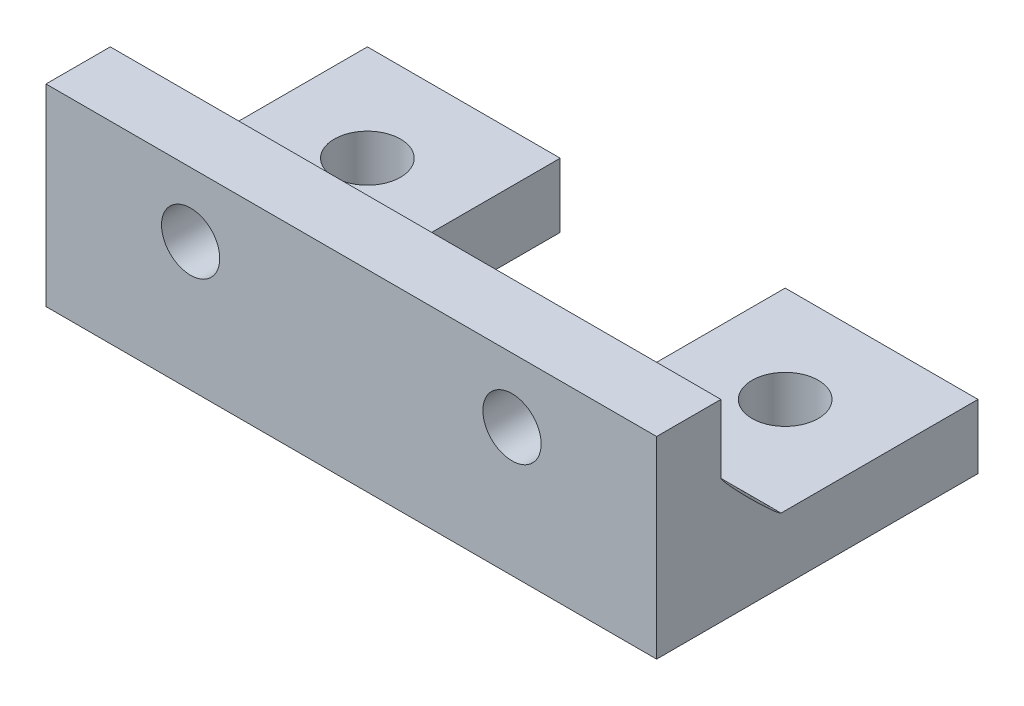
from build123d import *

# Parameters (mm, degrees)
SKETCH1_W           = 30.4
SKETCH1_H           = 6.4
BOSS_EXTRUDE1_DEPTH = 3.2
SKETCH2_W           = 9.6
SKETCH2_H           = 9.6
SKETCH2_R           = 1.65
BOSS_EXTRUDE2_DEPTH = 3.2
SKETCH3_W           = 30.4
SKETCH3_H           = 3.2
BOSS_EXTRUDE3_DEPTH = 6.4
FILLET2_SIZE        = 3
SKETCH4_R           = 1.45
CUT_EXTRUDE1_DEPTH  = 24
SKETCH5_R           = 2.75
CUT_EXTRUDE2_DEPTH  = 4


with BuildPart() as part:
    # Sketch1 → Boss-Extrude1 (new body)
    with BuildSketch(Plane(origin=(0, 0, 0), x_dir=(1, 0, 0), z_dir=(0, 1, 0))):
        with Locations((15.2, -3.2)):
            Rectangle(SKETCH1_W, SKETCH1_H)
    extrude(amount=BOSS_EXTRUDE1_DEPTH)

    # Sketch2 → Boss-Extrude2 (add)
    # profile 1 of 2: a face of its own
    with BuildSketch(Plane(origin=(0, 3.2, 0), x_dir=(1, 0, 0), z_dir=(0, 1, 0))):
        with Locations((4.8, 4.8)):
            Rectangle(SKETCH2_W, SKETCH2_H)
        with Locations(Location((4.8, 4.8, 0), (0, 0, 270))):
            Circle(SKETCH2_R, mode=Mode.SUBTRACT)
    # profile 2 of 2: a face of its own
    with BuildSketch(Plane(origin=(0, 3.2, 0), x_dir=(1, 0, 0), z_dir=(0, 1, 0))):
        with Locations((25.6, 4.8)):
            Rectangle(SKETCH2_W, SKETCH2_H)
        with Locations(Location((25.6, 4.8, 0), (0, 0, 270))):
            Circle(SKETCH2_R, mode=Mode.SUBTRACT)
    extrude(amount=-BOSS_EXTRUDE2_DEPTH)

    # Sketch3 → Boss-Extrude3 (add)
    with BuildSketch(Plane(origin=(0, 3.2, 0), x_dir=(1, 0, 0), z_dir=(0, 1, 0))):
        with Locations((15.2, -4.8)):
            Rectangle(SKETCH3_W, SKETCH3_H)
    extrude(amount=BOSS_EXTRUDE3_DEPTH)

    # Fillet2
    # a fillet whose section is not a circle: 3 mm, written as the material it adds along each edge
    with BuildSketch(Plane(origin=(30.4, 3.2, 3.2), x_dir=(0, 1, 0), z_dir=(-1, 0, 0))) as fillet2_piece_1:
        with BuildLine():
            Bezier((FILLET2_SIZE, 0), (0, 0), (0, FILLET2_SIZE), weights=[1, 0.052631579, 1])
            Line((0, FILLET2_SIZE), (0, 0))
            Line((0, 0), (FILLET2_SIZE, 0))
        make_face()
    extrude(amount=30.4)

    # Sketch4 → Cut-Extrude1 (cut)
    with BuildSketch(Plane.XY.offset(6.4)):
        with Locations((7.2, 6.4)):
            Circle(SKETCH4_R)
        with Locations((23.2, 6.4)):
            Circle(SKETCH4_R)
    extrude(amount=-CUT_EXTRUDE1_DEPTH, mode=Mode.SUBTRACT)

    # Sketch5 → Cut-Extrude2 (cut)
    with BuildSketch(Plane(origin=(0, 0, -0.8), x_dir=(-1, 0, 0), z_dir=(0, 0, -1))):
        with Locations((-23.2, 6.4)):
            Circle(SKETCH5_R)
        with Locations((-7.2, 6.4)):
            Circle(SKETCH5_R)
    extrude(amount=-CUT_EXTRUDE2_DEPTH, mode=Mode.SUBTRACT)


solid = part.part
